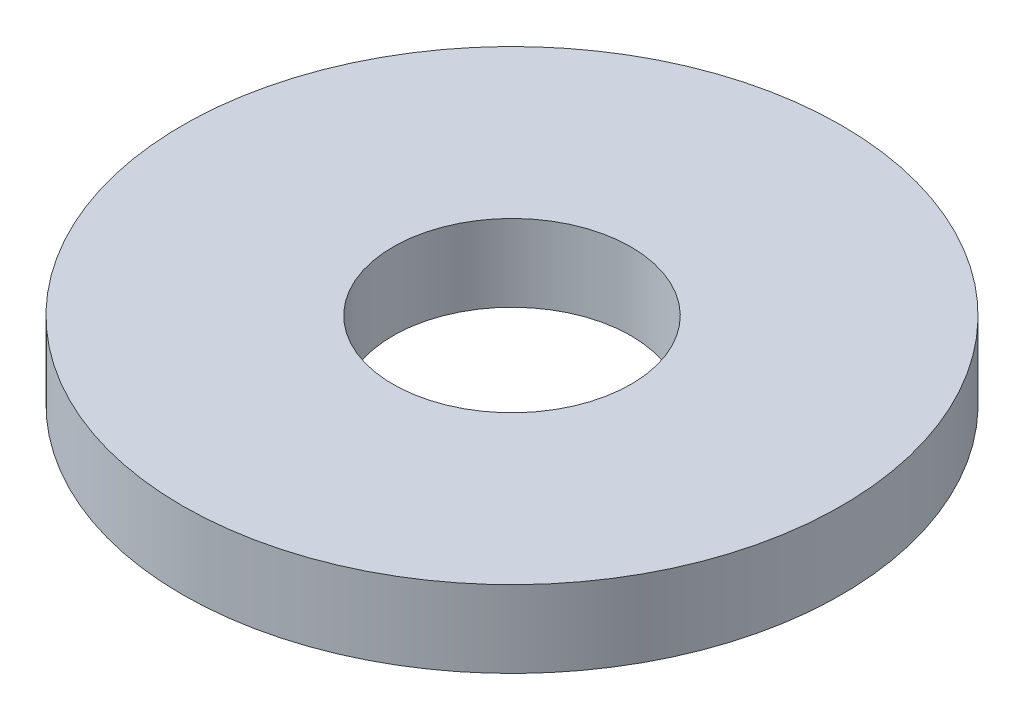
from build123d import *

# Parameters (mm, degrees)
SKETCH1_R           = 90
BOSS_EXTRUDE1_DEPTH = 21
SKETCH2_R           = 32.5
CUT_EXTRUDE1_DEPTH  = 130


with BuildPart() as part:
    # Sketch1 → Boss-Extrude1 (new body)
    with BuildSketch(Plane(origin=(0, 0, 0), x_dir=(1, 0, 0), z_dir=(0, 1, 0))):
        Circle(SKETCH1_R)
    extrude(amount=BOSS_EXTRUDE1_DEPTH)

    # Sketch2 → Cut-Extrude1 (cut, through all)
    with BuildSketch(Plane(origin=(0, 0, 0), x_dir=(1, 0, 0), z_dir=(0, 1, 0))):
        Circle(SKETCH2_R)
    extrude(amount=CUT_EXTRUDE1_DEPTH, mode=Mode.SUBTRACT)


solid = part.part
